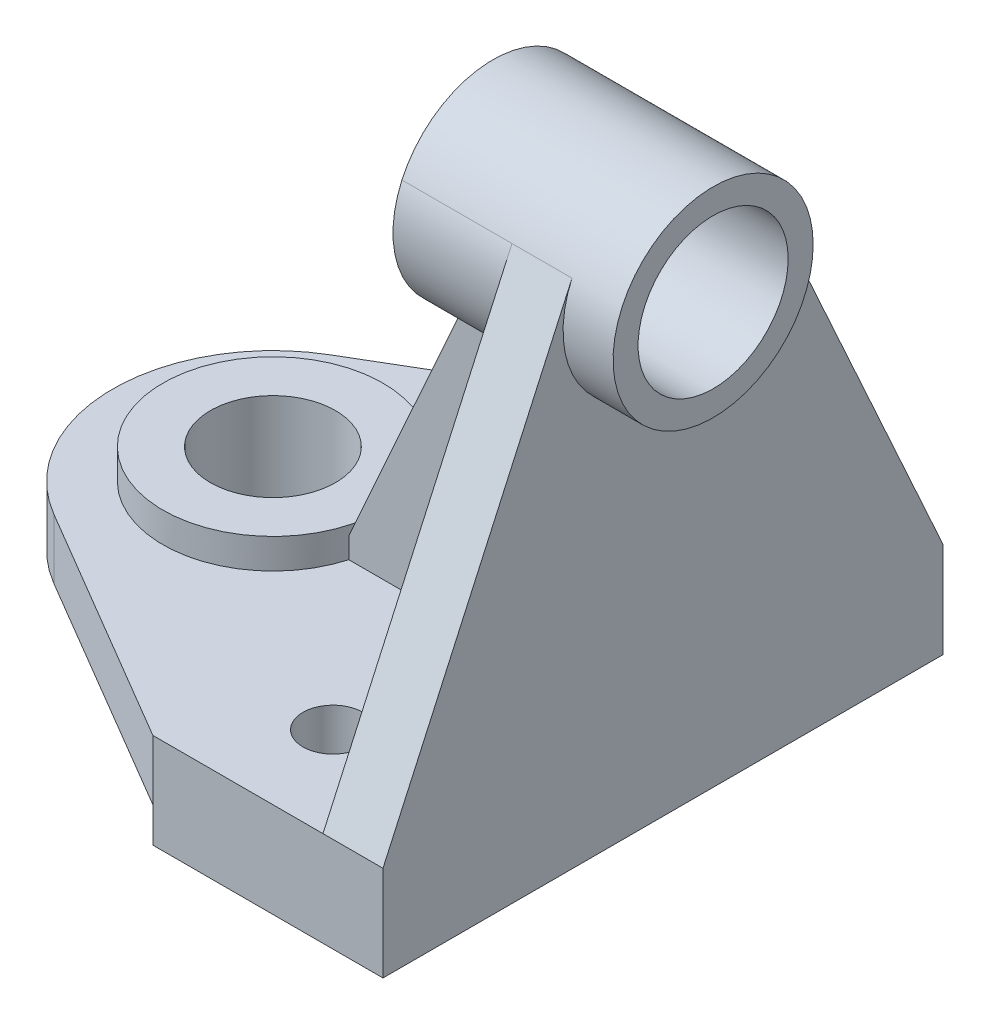
from build123d import *

# Parameters (mm, degrees)
SKETCH2_W                = 34
SKETCH2_H                = 112
SKETCH2_R                = 6
BOSS_EXTRUDE1_DEPTH      = 19
SKETCH2_3_R              = 22
BOSS_EXTRUDE2_DEPTH      = 12
BOSS_EXTRUDE3_DEPTH      = 6
BOSS_EXTRUDE3_DEPTH_BACK = 38
SKETCH2_4_R              = 22
SKETCH2_4_R_2            = 12.5
BOSS_EXTRUDE4_DEPTH      = 12
SKETCH3_3_R              = 15
BOSS_EXTRUDE5_DEPTH      = 22
RIB1_REACH               = 143.085
SKETCH4_WALL_W           = 337.882357436
SKETCH4_WALL_H           = 12


with BuildPart() as part:
    # Sketch2 → Boss-Extrude1 (new body)
    with BuildSketch(Plane(origin=(0, 0, 0), x_dir=(1, 0, 0), z_dir=(0, 1, 0))):
        with Locations((49, 0)):
            Rectangle(SKETCH2_W, SKETCH2_H)
        with Locations((49, -37)):
            Circle(SKETCH2_R, mode=Mode.SUBTRACT)
        with Locations((49, 37)):
            Circle(SKETCH2_R, mode=Mode.SUBTRACT)
    extrude(amount=-BOSS_EXTRUDE1_DEPTH)

    # Sketch2<3> → Boss-Extrude2 (add)
    with BuildSketch(Plane(origin=(0, 0, 0), x_dir=(1, 0, 0), z_dir=(0, 1, 0))):
        with BuildLine():
            Line((32, -56), (32, 56))
            Line((32, 56), (-16.246153846, 27.569230769))
            ThreePointArc((-16.246153846, 27.569230769), (-32, 0), (-16.246153846, -27.569230769))
            Line((-16.246153846, -27.569230769), (32, -56))
        make_face()
        Circle(SKETCH2_3_R, mode=Mode.SUBTRACT)
    extrude(amount=-BOSS_EXTRUDE2_DEPTH)

    # Sketch2<4> → Boss-Extrude3 (add, two sides: drawn at the far end of the back side and taken through both)
    with BuildSketch(Plane(origin=(0, 0, 0), x_dir=(1, 0, 0), z_dir=(0, 1, 0)).offset(-BOSS_EXTRUDE3_DEPTH_BACK)):
        Circle(SKETCH2_4_R)
        Circle(SKETCH2_4_R_2, mode=Mode.SUBTRACT)
    extrude(amount=BOSS_EXTRUDE3_DEPTH + BOSS_EXTRUDE3_DEPTH_BACK)

    # Sketch3 → Boss-Extrude4 (add)
    with BuildSketch(Plane(origin=(66, 0, 0), x_dir=(0, 0, -1), z_dir=(1, 0, 0))):
        with BuildLine():
            Line((56, -19), (56, 0))
            Line((56, 0), (18.212276668, 83.265166579))
            ThreePointArc((18.212276668, 83.265166579), (0, 55), (-18.212276668, 83.265166579))
            Line((-18.212276668, 83.265166579), (-56, 0))
            Line((-56, 0), (-56, -19))
            Line((-56, -19), (56, -19))
        make_face()
    extrude(amount=BOSS_EXTRUDE4_DEPTH)

    # Sketch3<3> → Boss-Extrude5 (add, symmetric)
    with BuildSketch(Plane(origin=(66, 0, 0), x_dir=(0, 0, -1), z_dir=(1, 0, 0))):
        with BuildLine():
            ThreePointArc((18.212276668, 83.265166579), (0, 95), (-18.212276668, 83.265166579))
            ThreePointArc((-18.212276668, 83.265166579), (-4.228147741, 55.452039322), (20, 75))
            ThreePointArc((20, 75), (19.547960678, 79.228147741), (18.212276668, 83.265166579))
        make_face()
        with Locations((0, 75)):
            Circle(SKETCH3_3_R, mode=Mode.SUBTRACT)
    extrude(amount=BOSS_EXTRUDE5_DEPTH, both=True)

    # Sketch4 wall → Rib1 (add, up to next)
    with BuildSketch(Plane(origin=(33, 30.5, 0), x_dir=(-0.409590402834, -0.912269533584, 0), z_dir=(0.912269533584, -0.409590402834, 0)), mode=Mode.PRIVATE) as rib1_sk1:
        Rectangle(SKETCH4_WALL_W, SKETCH4_WALL_H)
    rib1_tool1 = extrude(rib1_sk1.sketch, amount=RIB1_REACH, mode=Mode.PRIVATE) - part.part
    add(rib1_tool1.solids().sort_by_distance((33, 30.5, 0))[0])


solid = part.part
